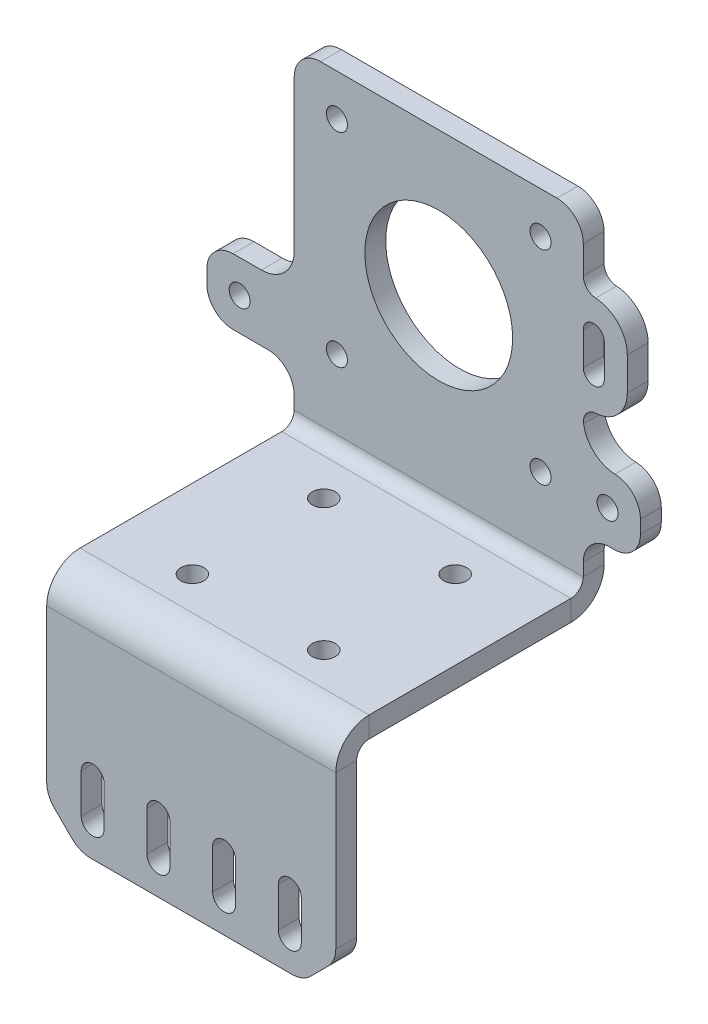
from build123d import *

# Parameters (mm, degrees)
SKETCH1_W                    = 44
SKETCH1_H                    = 34.5
SKETCH1_R                    = 1.75
BASE_FLANGE1_DEPTH           = 3.175
EDGE_FLANGE1_STRIP_W         = 16.51
EDGE_FLANGE1_STRIP_H         = 3.175
EDGE_FLANGE1_STRIP_CUT_DEPTH = 44
EDGE_FLANGE1_DEPTH           = 44
EDGE_FLANGE2_STRIP_W         = 16.51
EDGE_FLANGE2_STRIP_H         = 3.175
EDGE_FLANGE2_STRIP_CUT_DEPTH = 44
EDGE_FLANGE2_DEPTH           = 44
CUT_EXTRUDE1_REACH           = 70.083
SKETCH12_R                   = 11.25
SKETCH12_R_2                 = 1.6
CUT_EXTRUDE2_REACH           = 70.083
CHAMFER1_SIZE                = 5
SKETCH14_W                   = 8.7
SKETCH14_H                   = 10
SKETCH14_R                   = 1.6
SKETCH14_W_2                 = 13.3
BOSS_EXTRUDE1_DEPTH          = 3.175
FILLET2_R                    = 5
FILLET3_R                    = 4
BOSS_EXTRUDE3_START          = -3.175
BOSS_EXTRUDE3_DEPTH          = 3.175


# Sheet-metal steps are written as plain solids
with BuildPart() as part:
    # Sketch1 → Base-Flange1 (new body)
    with BuildSketch(Plane(origin=(0, 0, 0), x_dir=(1, 0, 0), z_dir=(0, 1, 0))):
        with Locations((0, 0.25)):
            Rectangle(SKETCH1_W, SKETCH1_H)
        with Locations(Location((-10, 10, 0), (0, 0, 270))):
            Circle(SKETCH1_R, mode=Mode.SUBTRACT)
        with Locations(Location((10, 10, 0), (0, 0, 270))):
            Circle(SKETCH1_R, mode=Mode.SUBTRACT)
        with Locations(Location((10, -10, 0), (0, 0, 270))):
            Circle(SKETCH1_R, mode=Mode.SUBTRACT)
        with Locations(Location((-10, -10, 0), (0, 0, 270))):
            Circle(SKETCH1_R, mode=Mode.SUBTRACT)
    extrude(amount=-BASE_FLANGE1_DEPTH)

    # Edge-Flange1 strip (across the edge) → Edge-Flange1 strip cut (cut)
    with BuildSketch(Plane(origin=(22, 0, -17.5), x_dir=(0, 0, 1), z_dir=(-1, 0, 0))):
        with Locations((-6.35, -1.5875)):
            Rectangle(EDGE_FLANGE1_STRIP_W, EDGE_FLANGE1_STRIP_H)
    extrude(amount=EDGE_FLANGE1_STRIP_CUT_DEPTH, mode=Mode.SUBTRACT)

    # Edge-Flange1 section (across the edge) → Edge-Flange1 (add)
    with BuildSketch(Plane(origin=(22, 0, -17.5), x_dir=(0, 0, 1), z_dir=(-1, 0, 0))):
        with BuildLine():
            Line((-3.175, 1.905), (-3.175, 49.825))
            Line((-3.175, 49.825), (0, 49.825))
            Line((0, 49.825), (0, 1.905))
            ThreePointArc((0, 1.905), (0.557961582, 0.557961582), (1.905, 0))
            Line((1.905, 0), (1.905, -3.175))
            ThreePointArc((1.905, -3.175), (-1.687102448, -1.687102448), (-3.175, 1.905))
        make_face()
    extrude(amount=EDGE_FLANGE1_DEPTH)

    # Edge-Flange2 strip (across the edge) → Edge-Flange2 strip cut (cut)
    with BuildSketch(Plane(origin=(22, -3.175, 17), x_dir=(0, 0, -1), z_dir=(-1, 0, 0))):
        with Locations((-6.35, -1.5875)):
            Rectangle(EDGE_FLANGE2_STRIP_W, EDGE_FLANGE2_STRIP_H)
    extrude(amount=EDGE_FLANGE2_STRIP_CUT_DEPTH, mode=Mode.SUBTRACT)

    # Edge-Flange2 section (across the edge) → Edge-Flange2 (add)
    with BuildSketch(Plane(origin=(22, -3.175, 17), x_dir=(0, 0, -1), z_dir=(-1, 0, 0))):
        with BuildLine():
            Line((-3.175, 1.905), (-3.175, 31.825))
            Line((-3.175, 31.825), (0, 31.825))
            Line((0, 31.825), (0, 1.905))
            ThreePointArc((0, 1.905), (0.557961582, 0.557961582), (1.905, 0))
            Line((1.905, 0), (1.905, -3.175))
            ThreePointArc((1.905, -3.175), (-1.687102448, -1.687102448), (-3.175, 1.905))
        make_face()
    extrude(amount=EDGE_FLANGE2_DEPTH)

    # Sketch12 → Cut-Extrude1 (cut, up to next)
    with BuildSketch(Plane(origin=(0, 0, -20.675), x_dir=(-1, 0, 0), z_dir=(0, 0, -1)), mode=Mode.PRIVATE) as cut_extrude1_sk1:
        with Locations(Location((0, 28, 0), (0, 0, 90))):
            Circle(SKETCH12_R)
    cut_extrude1_tool1 = extrude(cut_extrude1_sk1.sketch, amount=-CUT_EXTRUDE1_REACH, mode=Mode.PRIVATE) & part.part
    # Sketch12 → Cut-Extrude1 (cut, up to next)
    with BuildSketch(Plane(origin=(0, 0, -20.675), x_dir=(-1, 0, 0), z_dir=(0, 0, -1)), mode=Mode.PRIVATE) as cut_extrude1_sk2:
        with Locations(Location((15.5, 43.5, 0), (0, 0, 90))):
            Circle(SKETCH12_R_2)
    cut_extrude1_tool2 = extrude(cut_extrude1_sk2.sketch, amount=-CUT_EXTRUDE1_REACH, mode=Mode.PRIVATE) & part.part
    # Sketch12 → Cut-Extrude1 (cut, up to next)
    with BuildSketch(Plane(origin=(0, 0, -20.675), x_dir=(-1, 0, 0), z_dir=(0, 0, -1)), mode=Mode.PRIVATE) as cut_extrude1_sk3:
        with Locations(Location((15.5, 12.5, 0), (0, 0, 90))):
            Circle(SKETCH12_R_2)
    cut_extrude1_tool3 = extrude(cut_extrude1_sk3.sketch, amount=-CUT_EXTRUDE1_REACH, mode=Mode.PRIVATE) & part.part
    # Sketch12 → Cut-Extrude1 (cut, up to next)
    with BuildSketch(Plane(origin=(0, 0, -20.675), x_dir=(-1, 0, 0), z_dir=(0, 0, -1)), mode=Mode.PRIVATE) as cut_extrude1_sk4:
        with Locations(Location((-15.5, 12.5, 0), (0, 0, 90))):
            Circle(SKETCH12_R_2)
    cut_extrude1_tool4 = extrude(cut_extrude1_sk4.sketch, amount=-CUT_EXTRUDE1_REACH, mode=Mode.PRIVATE) & part.part
    # Sketch12 → Cut-Extrude1 (cut, up to next)
    with BuildSketch(Plane(origin=(0, 0, -20.675), x_dir=(-1, 0, 0), z_dir=(0, 0, -1)), mode=Mode.PRIVATE) as cut_extrude1_sk5:
        with Locations(Location((-15.5, 43.5, 0), (0, 0, 90))):
            Circle(SKETCH12_R_2)
    cut_extrude1_tool5 = extrude(cut_extrude1_sk5.sketch, amount=-CUT_EXTRUDE1_REACH, mode=Mode.PRIVATE) & part.part
    add(cut_extrude1_tool1.solids().sort_by_distance((0, 28, -20.675))[0], mode=Mode.SUBTRACT)
    add(cut_extrude1_tool2.solids().sort_by_distance((-15.5, 43.5, -20.675))[0], mode=Mode.SUBTRACT)
    add(cut_extrude1_tool3.solids().sort_by_distance((-15.5, 12.5, -20.675))[0], mode=Mode.SUBTRACT)
    add(cut_extrude1_tool4.solids().sort_by_distance((15.5, 12.5, -20.675))[0], mode=Mode.SUBTRACT)
    add(cut_extrude1_tool5.solids().sort_by_distance((15.5, 43.5, -20.675))[0], mode=Mode.SUBTRACT)

    # Sketch13 → Cut-Extrude2 (cut, up to next)
    with BuildSketch(Plane.XY.offset(20.175), mode=Mode.PRIVATE) as cut_extrude2_sk1:
        with BuildLine():
            Line((-6.75, -30.175), (-6.75, -24.175))
            ThreePointArc((-6.75, -24.175), (-5, -22.425), (-3.25, -24.175))
            Line((-3.25, -24.175), (-3.25, -30.175))
            ThreePointArc((-3.25, -30.175), (-5, -31.925), (-6.75, -30.175))
        make_face()
    cut_extrude2_tool1 = extrude(cut_extrude2_sk1.sketch, amount=-CUT_EXTRUDE2_REACH, mode=Mode.PRIVATE) & part.part
    # Sketch13 → Cut-Extrude2 (cut, up to next)
    with BuildSketch(Plane.XY.offset(20.175), mode=Mode.PRIVATE) as cut_extrude2_sk2:
        with BuildLine():
            Line((-16.75, -30.175), (-16.75, -24.175))
            ThreePointArc((-16.75, -24.175), (-15, -22.425), (-13.25, -24.175))
            Line((-13.25, -24.175), (-13.25, -30.175))
            ThreePointArc((-13.25, -30.175), (-15, -31.925), (-16.75, -30.175))
        make_face()
    cut_extrude2_tool2 = extrude(cut_extrude2_sk2.sketch, amount=-CUT_EXTRUDE2_REACH, mode=Mode.PRIVATE) & part.part
    # Sketch13 → Cut-Extrude2 (cut, up to next)
    with BuildSketch(Plane.XY.offset(20.175), mode=Mode.PRIVATE) as cut_extrude2_sk3:
        with BuildLine():
            Line((16.75, -30.175), (16.75, -24.175))
            ThreePointArc((16.75, -24.175), (15, -22.425), (13.25, -24.175))
            Line((13.25, -24.175), (13.25, -30.175))
            ThreePointArc((13.25, -30.175), (15, -31.925), (16.75, -30.175))
        make_face()
    cut_extrude2_tool3 = extrude(cut_extrude2_sk3.sketch, amount=-CUT_EXTRUDE2_REACH, mode=Mode.PRIVATE) & part.part
    # Sketch13 → Cut-Extrude2 (cut, up to next)
    with BuildSketch(Plane.XY.offset(20.175), mode=Mode.PRIVATE) as cut_extrude2_sk4:
        with BuildLine():
            Line((6.75, -30.175), (6.75, -24.175))
            ThreePointArc((6.75, -24.175), (5, -22.425), (3.25, -24.175))
            Line((3.25, -24.175), (3.25, -30.175))
            ThreePointArc((3.25, -30.175), (5, -31.925), (6.75, -30.175))
        make_face()
    cut_extrude2_tool4 = extrude(cut_extrude2_sk4.sketch, amount=-CUT_EXTRUDE2_REACH, mode=Mode.PRIVATE) & part.part
    add(cut_extrude2_tool1.solids().sort_by_distance((-5, -27.175, 20.175))[0], mode=Mode.SUBTRACT)
    add(cut_extrude2_tool2.solids().sort_by_distance((-15, -27.175, 20.175))[0], mode=Mode.SUBTRACT)
    add(cut_extrude2_tool3.solids().sort_by_distance((15, -27.175, 20.175))[0], mode=Mode.SUBTRACT)
    add(cut_extrude2_tool4.solids().sort_by_distance((5, -27.175, 20.175))[0], mode=Mode.SUBTRACT)

    # Chamfer1
    chamfer1_edges = [part.edges().sort_by_distance(p)[0] for p in [
        (22, -35, 18.5875),
        (-22, -35, 18.5875),
    ]]
    chamfer(chamfer1_edges, length=CHAMFER1_SIZE)

    # Sketch14 → Boss-Extrude1 (add)
    # profile 1 of 2: a face of its own
    with BuildSketch(Plane(origin=(0, 0, -20.675), x_dir=(-1, 0, 0), z_dir=(0, 0, -1))):
        with Locations((-26.35, 12.85)):
            Rectangle(SKETCH14_W, SKETCH14_H)
        with Locations(Location((-25.7, 12.85, 0), (0, 0, 90))):
            Circle(SKETCH14_R, mode=Mode.SUBTRACT)
    # profile 2 of 2: a face of its own
    with BuildSketch(Plane(origin=(0, 0, -20.675), x_dir=(-1, 0, 0), z_dir=(0, 0, -1))):
        with Locations((28.65, 12.85)):
            Rectangle(SKETCH14_W_2, SKETCH14_H)
        with Locations(Location((30.3, 12.85, 0), (0, 0, 90))):
            Circle(SKETCH14_R, mode=Mode.SUBTRACT)
    extrude(amount=-BOSS_EXTRUDE1_DEPTH)

    # Fillet2
    fillet2_edges = [part.edges().sort_by_distance(p)[0] for p in [
        (-22, 17.85, -19.0875),
        (22, 17.85, -19.0875),
    ]]
    fillet(fillet2_edges, radius=FILLET2_R)

    # Fillet3
    fillet3_edges = [part.edges().sort_by_distance(p)[0] for p in [
        (-35.3, 7.85, -19.0875),
        (-35.3, 17.85, -19.0875),
        (30.7, 7.85, -19.0875),
        (30.7, 17.85, -19.0875),
        (-22, 49.825, -19.0875),
        (22, 49.825, -19.0875),
        (-22, 7.85, -19.0875),
        (22, 7.85, -19.0875),
        (-22, -30, 18.5875),
        (-17, -35, 18.5875),
        (17, -35, 18.5875),
        (22, -30, 18.5875),
    ]]
    fillet(fillet3_edges, radius=FILLET3_R)

    # Sketch19 → Boss-Extrude3 (add)
    with BuildSketch(Plane(origin=(0, 0, -20.675), x_dir=(-1, 0, 0), z_dir=(0, 0, -1)).offset(BOSS_EXTRUDE3_START)):
        with BuildLine():
            ThreePointArc((-25.2, 34.5), (-23.6, 36.1), (-22, 34.5))
            Line((-22, 34.5), (-22, 41.588723439))
            ThreePointArc((-22, 41.588723439), (-22.546495251, 40.214924348), (-23.887323944, 39.591899935))
            ThreePointArc((-23.887323944, 39.591899935), (-27.306437111, 38.003187683), (-28.7, 34.5))
            Line((-28.7, 34.5), (-28.7, 29.5))
            ThreePointArc((-28.7, 29.5), (-27.314329906, 26.005181929), (-23.910292804, 24.409448127))
            ThreePointArc((-23.910292804, 24.409448127), (-22.479211599, 23.673677736), (-22.053293762, 22.121922124))
            ThreePointArc((-22.053293762, 22.121922124), (-22.013341239, 22.484987117), (-22, 22.85))
            Line((-22, 22.85), (-22, 29.5))
            ThreePointArc((-22, 29.5), (-23.6, 27.9), (-25.2, 29.5))
            Line((-25.2, 29.5), (-25.2, 34.5))
        make_face()
    extrude(amount=BOSS_EXTRUDE3_DEPTH)


solid = part.part
